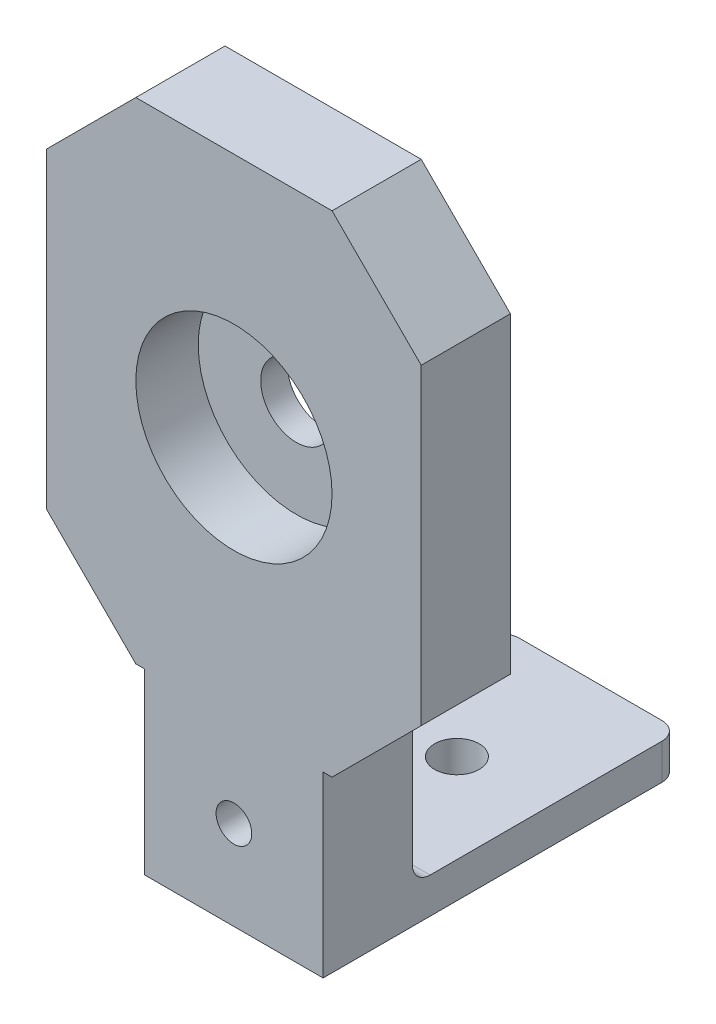
from build123d import *

# Parameters (mm, degrees)
ESTRUSIONE_ESTRUSIONE1_DEPTH = 10
SCHIZZO6_R                   = 11
TAGLIO_ESTRUSIONE4_DEPTH     = 7
SCHIZZO7_R                   = 4
TAGLIO_ESTRUSIONE5_DEPTH     = 53.404675364
SMUSSO2_SIZE                 = 10
SCHIZZO8_W                   = 20
SCHIZZO8_H                   = 4
ESTRUSIONE_ESTRUSIONE3_DEPTH = 30
SCHIZZO9_R                   = 2.5
TAGLIO_ESTRUSIONE6_DEPTH     = 35
RACCORDO1_R                  = 2
SCHIZZO10_R                  = 2
TAGLIO_ESTRUSIONE7_DEPTH     = 10


with BuildPart() as part:
    # Schizzo1 → Estrusione-Estrusione1 (new body)
    with BuildSketch(Plane.XY):
        Polygon((-10, -47.5), (10, -47.5), (10, -27.5), (21, -27.5), (21, 27.5), (-21, 27.5), (-21, -27.5), (-10, -27.5), align=None)
    extrude(amount=ESTRUSIONE_ESTRUSIONE1_DEPTH)

    # Schizzo6 → Taglio-Estrusione4 (cut)
    with BuildSketch(Plane.XY.offset(10)):
        Circle(SCHIZZO6_R)
    extrude(amount=-TAGLIO_ESTRUSIONE4_DEPTH, mode=Mode.SUBTRACT)

    # Schizzo7 → Taglio-Estrusione5 (cut, through all)
    with BuildSketch(Plane.XY.offset(3)):
        Circle(SCHIZZO7_R)
    extrude(amount=-TAGLIO_ESTRUSIONE5_DEPTH, mode=Mode.SUBTRACT)

    # Smusso2
    smusso2_edges = [part.edges().sort_by_distance(p)[0] for p in [
        (-21, -27.5, 5),
        (21, -27.5, 5),
        (21, 27.5, 5),
        (-21, 27.5, 5),
    ]]
    chamfer(smusso2_edges, length=SMUSSO2_SIZE)

    # Schizzo8 → Estrusione-Estrusione3 (add)
    with BuildSketch(Plane(origin=(0, 0, 0), x_dir=(-1, 0, 0), z_dir=(0, 0, -1))):
        with Locations((0, -45.5)):
            Rectangle(SCHIZZO8_W, SCHIZZO8_H)
    extrude(amount=ESTRUSIONE_ESTRUSIONE3_DEPTH)

    # Schizzo9 → Taglio-Estrusione6 (cut)
    with BuildSketch(Plane(origin=(0, -43.5, 0), x_dir=(1, 0, 0), z_dir=(0, 1, 0))):
        with Locations((0, 15)):
            Circle(SCHIZZO9_R)
    extrude(amount=-TAGLIO_ESTRUSIONE6_DEPTH, mode=Mode.SUBTRACT)

    # Raccordo1
    raccordo1_edges = [part.edges().sort_by_distance(p)[0] for p in [
        (0, -43.5, 0),
        (-10, -45.5, -30),
        (10, -45.5, -30),
    ]]
    fillet(raccordo1_edges, radius=RACCORDO1_R)

    # Schizzo10 → Taglio-Estrusione7 (cut)
    with BuildSketch(Plane(origin=(0, 0, 0), x_dir=(-1, 0, 0), z_dir=(0, 0, -1))):
        with Locations((0, -37.5)):
            Circle(SCHIZZO10_R)
    extrude(amount=-TAGLIO_ESTRUSIONE7_DEPTH, mode=Mode.SUBTRACT)


solid = part.part
